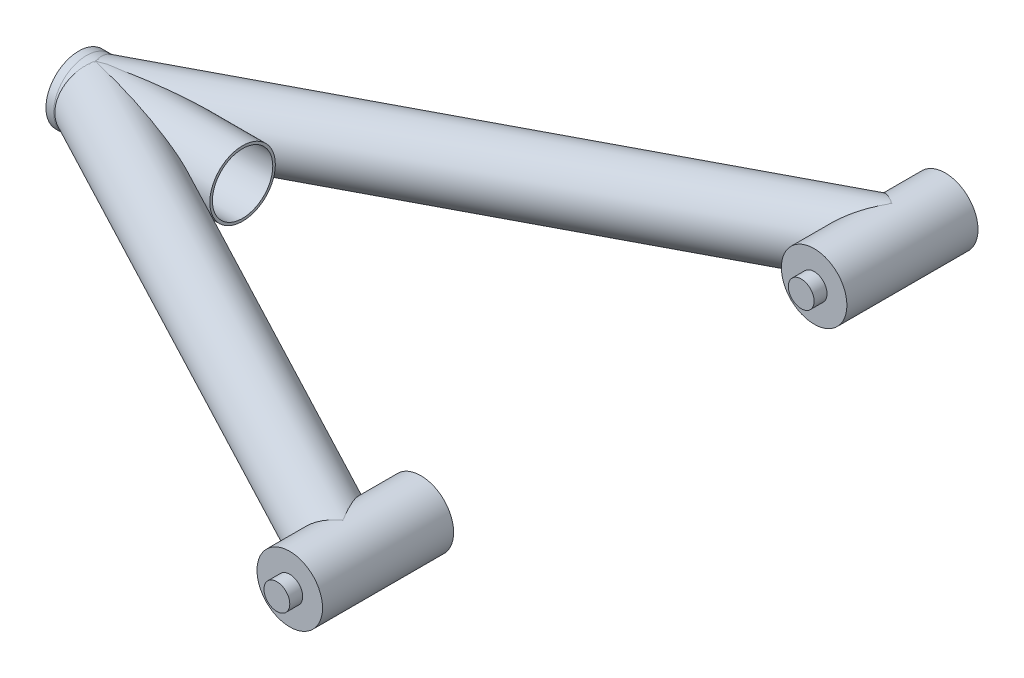
from build123d import *

# Parameters (mm, degrees)
ONEINCH_START                          = 87.544697124
ONEINCH_PIPE_ONE_INCH_1_OUTLINE_R      = 12.7
ONEINCH_PIPE_ONE_INCH_1_OUTLINE_R_2    = 11.7
ONEINCH_PIPE_ONE_INCH_1_DEPTH          = 156.098206181
ONEINCH_START_2                        = 36.151550895
ONEINCH_PIPE_ONE_INCH_1_2_OUTLINE_R    = 12.7
ONEINCH_PIPE_ONE_INCH_1_2_OUTLINE_R_2  = 11.7
ONEINCH_PIPE_ONE_INCH_1_2_DEPTH        = 228.528229631
ONEINCH_START_3                        = -11.238198245
ONEINCH_PIPE_ONE_INCH_1_3_DEPTH        = 14.210948616
ONEINCH_START_4                        = 2.972750371
ONEINCH_PIPE_ONE_INCH_1_4_DEPTH        = 114.710654538
ONEINCH_START_5                        = 34.938462135
ONEINCH_PIPE_ONE_INCH_1_5_DEPTH        = 213.589231941
ONEINCH_PIPE_ONE_INCH_1_6_OUTLINE_R    = 12.7
ONEINCH_PIPE_ONE_INCH_1_6_OUTLINE_R_2  = 11.7
ONEINCH_PIPE_ONE_INCH_1_6_DEPTH        = 156.098206181
ONEINCH_PIPE_ONE_INCH_1_7_OUTLINE_R    = 12.7
ONEINCH_PIPE_ONE_INCH_1_7_OUTLINE_R_2  = 11.7
ONEINCH_PIPE_ONE_INCH_1_7_DEPTH        = 228.528229631
ONEINCH_START_6                        = -2.972750371
ONEINCH_PIPE_ONE_INCH_1_8_DEPTH        = 14.210948616
ONEINCH_START_7                        = -117.683404909
ONEINCH_PIPE_ONE_INCH_1_9_DEPTH        = 114.710654538
ONEINCH_PIPE_ONE_INCH_1_10_DEPTH       = 213.589231941
ONEINCH_START_8                        = 37.29
ONEINCH_PIPE_ONE_INCH_1_11_OUTLINE_R   = 12.7
ONEINCH_PIPE_ONE_INCH_1_11_OUTLINE_R_2 = 11.7
ONEINCH_PIPE_ONE_INCH_1_11_DEPTH       = 60.5
ONEINCH_START_9                        = 76.2
ONEINCH_PIPE_ONE_INCH_1_12_OUTLINE_R   = 12.7
ONEINCH_PIPE_ONE_INCH_1_12_OUTLINE_R_2 = 11.7
ONEINCH_PIPE_ONE_INCH_1_12_DEPTH       = 50.8
ONEINCH_START_10                       = -127
ONEINCH_PIPE_ONE_INCH_1_13_OUTLINE_R   = 12.7
ONEINCH_PIPE_ONE_INCH_1_13_OUTLINE_R_2 = 11.7
ONEINCH_PIPE_ONE_INCH_1_13_DEPTH       = 50.8
SKETCH16_R                             = 12.7
SKETCH16_R_2                           = 6
WASHERS_ONEINCHDIA12MM_1_DEPTH         = 3
SKETCH110_R                            = 12.7
SKETCH110_R_2                          = 5
SUSPENSIONMOUNT_BUSHING10MM_1_DEPTH    = 50.8
SKETCH110_ON_SEGMENT_2_R               = 12.7
SKETCH110_ON_SEGMENT_2_R_2             = 5
SUSPENSIONMOUNT_BUSHING10MM_1_2_DEPTH  = 50.8
BOSS_EXTRUDE1_DEPTH                    = 5
BOSS_EXTRUDE1_DEPTH_BACK               = 55.8
SKETCH112_R                            = 5
BOSS_EXTRUDE2_DEPTH                    = 5
BOSS_EXTRUDE2_DEPTH_BACK               = 55.8
SKETCH111_R                            = 5


with BuildPart() as part:
    # Oneinch PIPE_ONE_INCH(1): read off the stored shape, not the designer's step
    # Oneinch PIPE_ONE_INCH(1) outline → Oneinch PIPE_ONE_INCH(1) (new body)
    with BuildSketch(Plane(origin=(0, 0, 0), x_dir=(0.4657858109212566, 0, -0.8848974959533038), z_dir=(0.8848974959533038, 0, 0.46578581092125687)).offset(ONEINCH_START)):
        with Locations((19.029186514, 0)):
            Circle(ONEINCH_PIPE_ONE_INCH_1_OUTLINE_R)
        with Locations((19.029186514, 0)):
            Circle(ONEINCH_PIPE_ONE_INCH_1_OUTLINE_R_2, mode=Mode.SUBTRACT)
    extrude(amount=ONEINCH_PIPE_ONE_INCH_1_DEPTH)

    # Oneinch PIPE_ONE_INCH_1 2 outline → Oneinch PIPE_ONE_INCH_1 2 (add)
    with BuildSketch(Plane(origin=(0, 0, 0), x_dir=(0.4657858109212566, 0, -0.8848974959533038), z_dir=(0.8848974959533038, 0, 0.46578581092125687)).offset(ONEINCH_START_2)):
        with Locations((19.029186514, 0)):
            Circle(ONEINCH_PIPE_ONE_INCH_1_2_OUTLINE_R)
        with Locations((19.029186514, 0)):
            Circle(ONEINCH_PIPE_ONE_INCH_1_2_OUTLINE_R_2, mode=Mode.SUBTRACT)
    extrude(amount=ONEINCH_PIPE_ONE_INCH_1_2_DEPTH)

    # Oneinch PIPE_ONE_INCH_1 3 outline → Oneinch PIPE_ONE_INCH_1 3 (cut)
    with BuildSketch(Plane.XY.offset(ONEINCH_START_3)):
        with BuildLine():
            Line((250, -12.7), (243.078, -12.7))
            ThreePointArc((243.078, -12.7), (230.378, 0), (243.078, 12.7))
            Line((243.078, 12.7), (250, 12.7))
            Line((250, 12.7), (250, 14))
            Line((250, 14), (65, 14))
            Line((65, 14), (65, -14))
            Line((65, -14), (250, -14))
            Line((250, -14), (250, -12.7))
        make_face()
    extrude(amount=ONEINCH_PIPE_ONE_INCH_1_3_DEPTH, mode=Mode.SUBTRACT)

    # Oneinch PIPE_ONE_INCH_1 4 outline → Oneinch PIPE_ONE_INCH_1 4 (cut)
    with BuildSketch(Plane.XY.offset(ONEINCH_START_4)):
        with BuildLine():
            ThreePointArc((243.078, 12.7), (230.378, 0), (243.078, -12.7))
            Line((243.078, -12.7), (250, -12.7))
            Line((250, -12.7), (250, 12.7))
            Line((250, 12.7), (243.078, 12.7))
        make_face()
    extrude(amount=ONEINCH_PIPE_ONE_INCH_1_4_DEPTH, mode=Mode.SUBTRACT)

    # Oneinch PIPE_ONE_INCH_1 5 outline → Oneinch PIPE_ONE_INCH_1 5 (cut)
    with BuildSketch(Plane.YZ.offset(ONEINCH_START_5)):
        with BuildLine():
            ThreePointArc((12.7, 0), (0, 12.7), (-12.7, 0))
            Line((-12.7, 0), (-12.7, -13))
            Line((-12.7, -13), (12.7, -13))
            Line((12.7, -13), (12.7, 0))
        make_face()
    extrude(amount=ONEINCH_PIPE_ONE_INCH_1_5_DEPTH, mode=Mode.SUBTRACT)


with BuildPart() as body_2:
    # Oneinch PIPE_ONE_INCH_1 6 outline → Oneinch PIPE_ONE_INCH_1 6 (new body)
    with BuildSketch(Plane(origin=(0, 0, 0), x_dir=(0.4657858109212566, 0, 0.8848974959533038), z_dir=(0.8848974959533038, 0, -0.46578581092125687)).offset(ONEINCH_START)):
        with Locations((19.029186514, 0)):
            Circle(ONEINCH_PIPE_ONE_INCH_1_6_OUTLINE_R)
        with Locations((19.029186514, 0)):
            Circle(ONEINCH_PIPE_ONE_INCH_1_6_OUTLINE_R_2, mode=Mode.SUBTRACT)
    extrude(amount=ONEINCH_PIPE_ONE_INCH_1_6_DEPTH)

    # Oneinch PIPE_ONE_INCH_1 7 outline → Oneinch PIPE_ONE_INCH_1 7 (add)
    with BuildSketch(Plane(origin=(0, 0, 0), x_dir=(0.4657858109212566, 0, 0.8848974959533038), z_dir=(0.8848974959533038, 0, -0.46578581092125687)).offset(ONEINCH_START_2)):
        with Locations((19.029186514, 0)):
            Circle(ONEINCH_PIPE_ONE_INCH_1_7_OUTLINE_R)
        with Locations((19.029186514, 0)):
            Circle(ONEINCH_PIPE_ONE_INCH_1_7_OUTLINE_R_2, mode=Mode.SUBTRACT)
    extrude(amount=ONEINCH_PIPE_ONE_INCH_1_7_DEPTH)

    # Oneinch PIPE_ONE_INCH_1 8 outline → Oneinch PIPE_ONE_INCH_1 8 (cut)
    with BuildSketch(Plane.XY.offset(ONEINCH_START_6)):
        with BuildLine():
            Line((250, -12.7), (243.078, -12.7))
            ThreePointArc((243.078, -12.7), (230.378, 0), (243.078, 12.7))
            Line((243.078, 12.7), (250, 12.7))
            Line((250, 12.7), (250, 14))
            Line((250, 14), (65, 14))
            Line((65, 14), (65, -14))
            Line((65, -14), (250, -14))
            Line((250, -14), (250, -12.7))
        make_face()
    extrude(amount=ONEINCH_PIPE_ONE_INCH_1_8_DEPTH, mode=Mode.SUBTRACT)

    # Oneinch PIPE_ONE_INCH_1 9 outline → Oneinch PIPE_ONE_INCH_1 9 (cut)
    with BuildSketch(Plane.XY.offset(ONEINCH_START_7)):
        with BuildLine():
            ThreePointArc((243.078, 12.7), (230.378, 0), (243.078, -12.7))
            Line((243.078, -12.7), (250, -12.7))
            Line((250, -12.7), (250, 12.7))
            Line((250, 12.7), (243.078, 12.7))
        make_face()
    extrude(amount=ONEINCH_PIPE_ONE_INCH_1_9_DEPTH, mode=Mode.SUBTRACT)

    # Oneinch PIPE_ONE_INCH_1 10 outline → Oneinch PIPE_ONE_INCH_1 10 (cut)
    with BuildSketch(Plane.YZ.offset(ONEINCH_START_5)):
        with BuildLine():
            ThreePointArc((-12.7, 0), (0, -12.7), (12.7, 0))
            Line((12.7, 0), (12.7, 13))
            Line((12.7, 13), (-12.7, 13))
            Line((-12.7, 13), (-12.7, 0))
        make_face()
    extrude(amount=ONEINCH_PIPE_ONE_INCH_1_10_DEPTH, mode=Mode.SUBTRACT)


with BuildPart() as body_3:
    # Oneinch PIPE_ONE_INCH_1 11 outline → Oneinch PIPE_ONE_INCH_1 11 (new body)
    with BuildSketch(Plane.YZ.offset(ONEINCH_START_8)):
        Circle(ONEINCH_PIPE_ONE_INCH_1_11_OUTLINE_R)
        Circle(ONEINCH_PIPE_ONE_INCH_1_11_OUTLINE_R_2, mode=Mode.SUBTRACT)
    extrude(amount=ONEINCH_PIPE_ONE_INCH_1_11_DEPTH)


with BuildPart() as body_4:
    # Oneinch PIPE_ONE_INCH_1 12 outline → Oneinch PIPE_ONE_INCH_1 12 (new body)
    with BuildSketch(Plane.XY.offset(ONEINCH_START_9)):
        with Locations((243.078, 0)):
            Circle(ONEINCH_PIPE_ONE_INCH_1_12_OUTLINE_R)
        with Locations((243.078, 0)):
            Circle(ONEINCH_PIPE_ONE_INCH_1_12_OUTLINE_R_2, mode=Mode.SUBTRACT)
    extrude(amount=ONEINCH_PIPE_ONE_INCH_1_12_DEPTH)


with BuildPart() as body_5:
    # Oneinch PIPE_ONE_INCH_1 13 outline → Oneinch PIPE_ONE_INCH_1 13 (new body)
    with BuildSketch(Plane.XY.offset(ONEINCH_START_10)):
        with Locations((243.078, 0)):
            Circle(ONEINCH_PIPE_ONE_INCH_1_13_OUTLINE_R)
        with Locations((243.078, 0)):
            Circle(ONEINCH_PIPE_ONE_INCH_1_13_OUTLINE_R_2, mode=Mode.SUBTRACT)
    extrude(amount=ONEINCH_PIPE_ONE_INCH_1_13_DEPTH)


with BuildPart() as body_6:
    # Sketch16 → Washers ONEINCHDIA12MM(1) (new body)
    with BuildSketch(Plane(origin=(34.29, 0, 0), x_dir=(0, 0, -1), z_dir=(1, 0, 0))):
        Circle(SKETCH16_R)
        Circle(SKETCH16_R_2, mode=Mode.SUBTRACT)
    extrude(amount=WASHERS_ONEINCHDIA12MM_1_DEPTH)


with BuildPart() as body_5_2:
    # Sketch110 → Suspensionmount BUSHING10MM(1) (new body)
    with BuildSketch(Plane(origin=(243.078, 0, -127), x_dir=(1, 0, 0), z_dir=(0, 0, 1))):
        Circle(SKETCH110_R)
        Circle(SKETCH110_R_2, mode=Mode.SUBTRACT)
    extrude(amount=SUSPENSIONMOUNT_BUSHING10MM_1_DEPTH)


with BuildPart() as body_6_2:
    # Sketch110 on segment 2 (carried to segment 2) → Suspensionmount BUSHING10MM_1 2 (new body)
    with BuildSketch(Plane(origin=(243.078, 0, 76.2), x_dir=(1, 0, 0), z_dir=(0, 0, 1))):
        Circle(SKETCH110_ON_SEGMENT_2_R)
        Circle(SKETCH110_ON_SEGMENT_2_R_2, mode=Mode.SUBTRACT)
    extrude(amount=SUSPENSIONMOUNT_BUSHING10MM_1_2_DEPTH)


with BuildPart() as body_7:
    # Sketch112 → Boss-Extrude1 (new, two sides: drawn at the far end of the back side and taken through both)
    with BuildSketch(Plane.XY.offset(127).offset(-BOSS_EXTRUDE1_DEPTH_BACK)):
        with Locations((243.078, 0)):
            Circle(SKETCH112_R)
    extrude(amount=BOSS_EXTRUDE1_DEPTH + BOSS_EXTRUDE1_DEPTH_BACK)


with BuildPart() as body_8:
    # Sketch111 → Boss-Extrude2 (new, two sides: drawn at the far end of the back side and taken through both)
    with BuildSketch(Plane.XY.offset(-76.2).offset(-BOSS_EXTRUDE2_DEPTH_BACK)):
        with Locations((243.078, 0)):
            Circle(SKETCH111_R)
    extrude(amount=BOSS_EXTRUDE2_DEPTH + BOSS_EXTRUDE2_DEPTH_BACK)


solid = Compound([part.part, body_2.part, body_3.part, body_6.part, body_5_2.part, body_6_2.part, body_7.part, body_8.part])
